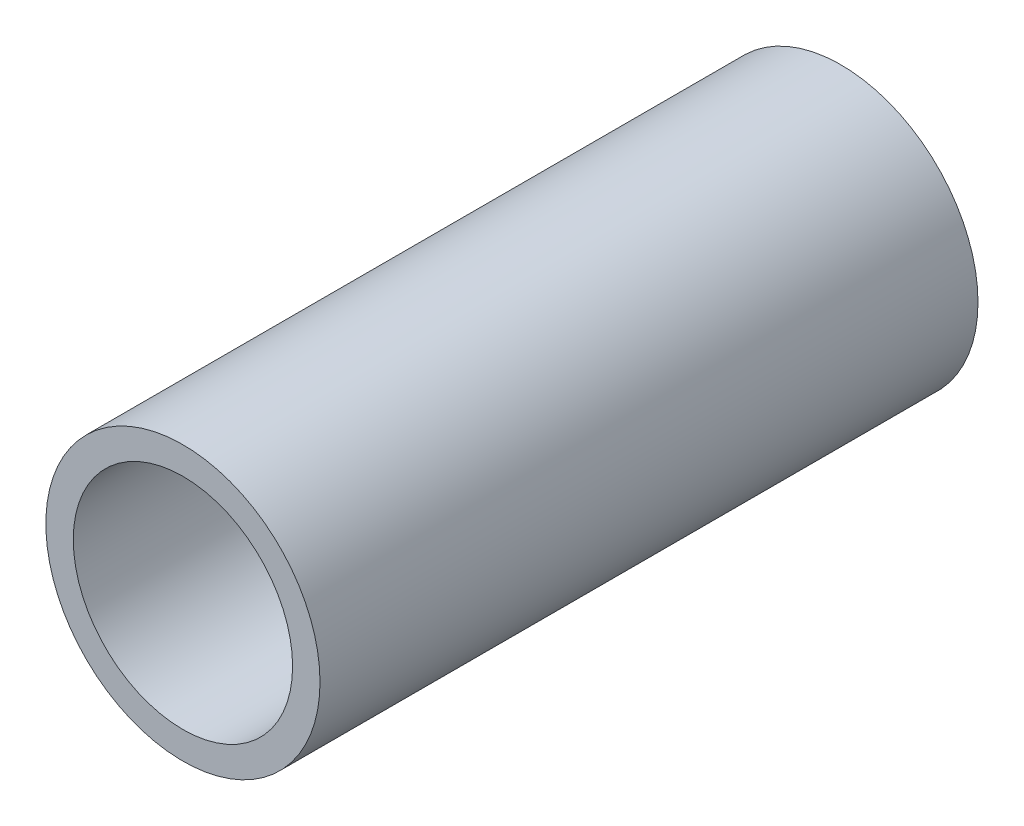
from build123d import *

# Parameters (mm, degrees)
SKETCH1_R           = 7.9375
SKETCH1_R_2         = 6.35
BOSS_EXTRUDE1_DEPTH = 19.05


with BuildPart() as part:
    # Sketch1 → Boss-Extrude1 (new, symmetric)
    with BuildSketch(Plane.XY):
        Circle(SKETCH1_R)
        Circle(SKETCH1_R_2, mode=Mode.SUBTRACT)
    extrude(amount=BOSS_EXTRUDE1_DEPTH, both=True)


solid = part.part
